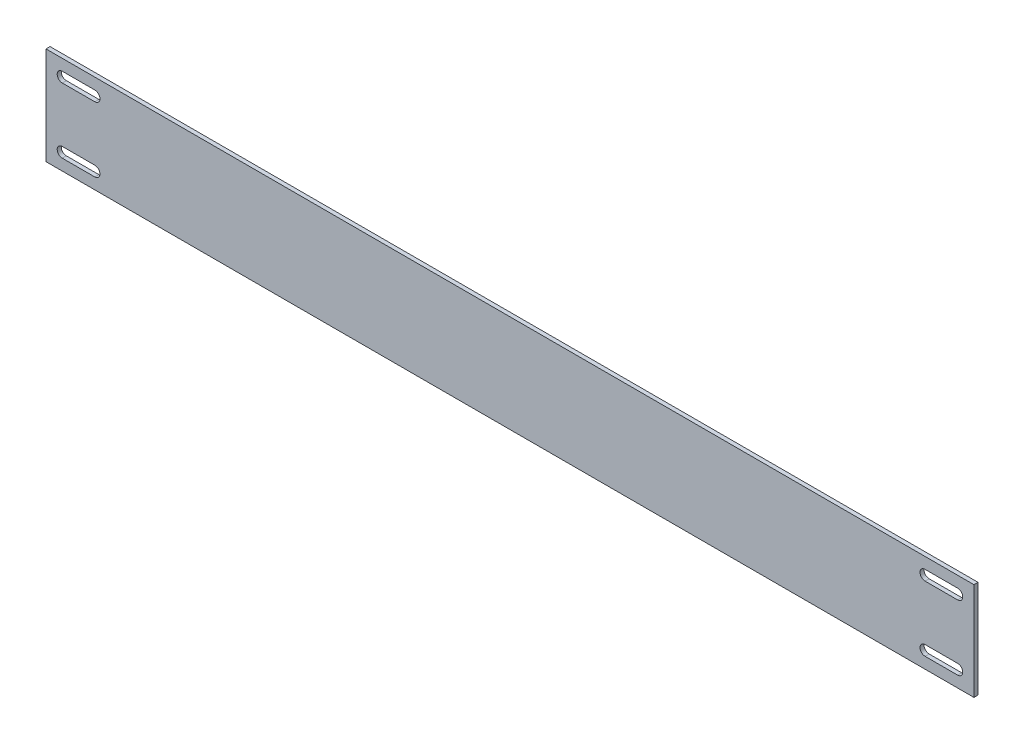
from build123d import *

# Parameters (mm, degrees)
BOSS_EXTRUDE1_DEPTH = 38.1
CUT_EXTRUDE2_DEPTH  = 364.95320119


with BuildPart() as part:
    # Sketch1 → Boss-Extrude1 (new body)
    with BuildSketch(Plane(origin=(0, 0, 0), x_dir=(1, 0, 0), z_dir=(0, 1, 0))):
        Polygon((0, 0), (361.95, 0), (361.95, 1.5875), (336.55, 1.5875), (25.4, 1.5875), (0, 1.5875), align=None)
    extrude(amount=BOSS_EXTRUDE1_DEPTH)

    # Sketch2 → Cut-Extrude2 (cut, through all)
    with BuildSketch(Plane(origin=(0, 0, -1.5875), x_dir=(-1, 0, 0), z_dir=(0, 0, -1))):
        with BuildLine():
            Line((-6.35, 33.734375), (-19.05, 33.734375))
            ThreePointArc((-19.05, 33.734375), (-21.034375, 31.75), (-19.05, 29.765625))
            Line((-19.05, 29.765625), (-6.35, 29.765625))
            ThreePointArc((-6.35, 29.765625), (-4.365625, 31.75), (-6.35, 33.734375))
        make_face()
        with BuildLine():
            ThreePointArc((-19.05, 8.334375), (-21.034375, 6.35), (-19.05, 4.365625))
            Line((-19.05, 4.365625), (-6.35, 4.365625))
            ThreePointArc((-6.35, 4.365625), (-4.365625, 6.35), (-6.35, 8.334375))
            Line((-6.35, 8.334375), (-19.05, 8.334375))
        make_face()
        with BuildLine():
            Line((-355.6, 4.365625), (-342.9, 4.365625))
            ThreePointArc((-342.9, 4.365625), (-340.915625, 6.35), (-342.9, 8.334375))
            Line((-342.9, 8.334375), (-355.6, 8.334375))
            ThreePointArc((-355.6, 8.334375), (-357.584375, 6.35), (-355.6, 4.365625))
        make_face()
        with BuildLine():
            ThreePointArc((-342.9, 29.765625), (-340.915625, 31.75), (-342.9, 33.734375))
            Line((-342.9, 33.734375), (-355.6, 33.734375))
            ThreePointArc((-355.6, 33.734375), (-357.584375, 31.75), (-355.6, 29.765625))
            Line((-355.6, 29.765625), (-342.9, 29.765625))
        make_face()
    extrude(amount=-CUT_EXTRUDE2_DEPTH, mode=Mode.SUBTRACT)


solid = part.part
